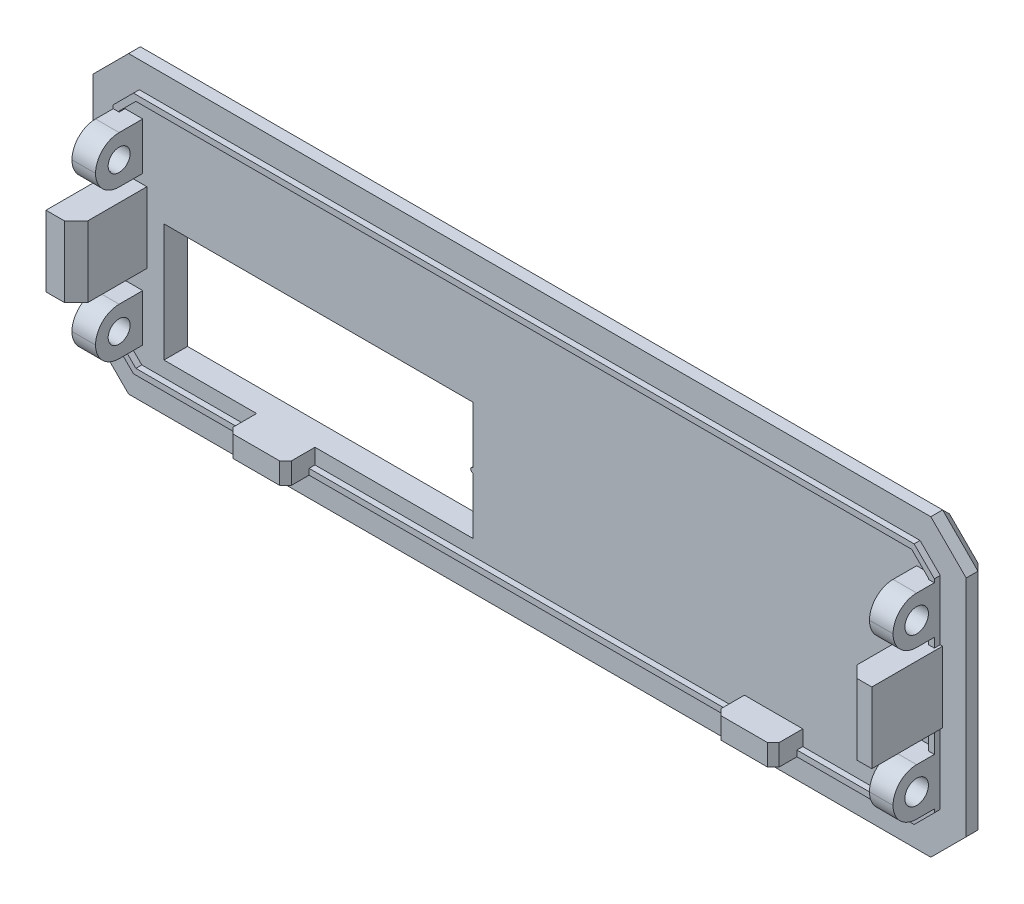
from build123d import *

# Parameters (mm, degrees)
EXTRUDE_1_DEPTH               = 2
CHAMFER_1_SIZE                = 1
SKETCH_3_W                    = 2
SKETCH_3_H                    = 4
EXTRUDE_2_DEPTH               = 4
FILLET_1_R                    = 2
SKETCH_4_R                    = 1
CUT_EXTRUDE_1_DEPTH           = 2
CUT_EXTRUDE_1_DRAFT           = -2
CUT_EXTRUDE_1_PROFILE_2_DEPTH = 2
CUT_EXTRUDE_1_PROFILE_2_DRAFT = -2
SKETCH_5_R                    = 1
CUT_EXTRUDE_2_DEPTH           = 2
CUT_EXTRUDE_2_DRAFT           = -2
CUT_EXTRUDE_2_PROFILE_2_DEPTH = 2
CUT_EXTRUDE_2_PROFILE_2_DRAFT = -2
SKETCH_8_W                    = 2.55
SKETCH_8_H                    = 6
SKETCH_8_W_2                  = 2.25
EXTRUDE_5_DEPTH               = 6
CHAMFER_3_SIZE                = 1
CUT_EXTRUDE_3_REACH           = 46.057
SKETCH_10_W                   = 26.2
SKETCH_10_H                   = 10
EXTRUDE_7_DEPTH               = 0.5
SKETCH_12_W                   = 4.95
SKETCH_12_H                   = 1.8
EXTRUDE_8_DEPTH               = 2.5
CHAMFER_4_SIZE                = 0.5
SKETCH_13_R                   = 0.2
EXTRUDE_9_DEPTH               = 2


with BuildPart() as part:
    # 草图1 → 凸台-拉伸1 (new body)
    with BuildSketch(Plane.XY):
        Polygon((-39.76383505, 4.799206062), (-36.76383505, 7.799206062), (31.23616495, 7.799206062), (34.23616495, 4.799206062), (34.23616495, -14.200793938), (31.23616495, -17.200793938), (-36.76383505, -17.200793938), (-39.76383505, -14.200793938), align=None)
    extrude(amount=EXTRUDE_1_DEPTH)

    # 倒角1
    chamfer_1_edges = [part.edges().sort_by_distance(p)[0] for p in [
        (-38.26383505, -15.700793938, 0),
        (-39.76383505, -4.700793938, 0),
        (-38.26383505, 6.299206062, 0),
        (-2.76383505, 7.799206062, 0),
        (32.73616495, 6.299206062, 0),
        (34.23616495, -4.700793938, 0),
        (32.73616495, -15.700793938, 0),
        (-2.76383505, -17.200793938, 0),
    ]]
    chamfer(chamfer_1_edges, length=CHAMFER_1_SIZE)

    # 草图3 → 凸台-拉伸2 (add)
    with BuildSketch(Plane.XY.offset(2)):
        with Locations((-36.56383505, 1.599206062)):
            Rectangle(SKETCH_3_W, SKETCH_3_H)
        with Locations((-36.56383505, -11.000793938)):
            Rectangle(SKETCH_3_W, SKETCH_3_H)
        with Locations((31.03616495, 1.599206062)):
            Rectangle(SKETCH_3_W, SKETCH_3_H)
        with Locations((31.03616495, -11.000793938)):
            Rectangle(SKETCH_3_W, SKETCH_3_H)
    extrude(amount=EXTRUDE_2_DEPTH)

    # 圆角1
    fillet_1_edges = [part.edges().sort_by_distance(p)[0] for p in [
        (31.03616495, 3.599206062, 6),
        (31.03616495, -0.400793938, 6),
        (31.03616495, -9.000793938, 6),
        (31.03616495, -13.000793938, 6),
        (-36.56383505, -13.000793938, 6),
        (-36.56383505, -9.000793938, 6),
        (-36.56383505, 3.599206062, 6),
        (-36.56383505, -0.400793938, 6),
    ]]
    fillet(fillet_1_edges, radius=FILLET_1_R - 0.0001)  # a hair under: the kernel refuses the full size


with BuildPart() as cut_extrude_1_tool:
    # 草图4 → 切除-拉伸1 (with draft: the straight prism first)
    with BuildSketch(Plane(origin=(32.03616495, 0, 0), x_dir=(0, 0, -1), z_dir=(1, 0, 0))):
        with Locations((-4, 1.599206062)):
            Circle(SKETCH_4_R)
    extrude(amount=-CUT_EXTRUDE_1_DEPTH)
    # 切除-拉伸1: the draft: its side faces are tilted about the plane it starts from
    cut_extrude_1_sides = [cut_extrude_1_tool.faces().sort_by_distance(p)[0] for p in [
        (31.03616495, 1.599206062, 5),
    ]]
    draft(cut_extrude_1_sides, Plane(origin=(32.03616495, 0, 0), x_dir=(0, 0, -1), z_dir=(1, 0, 0)), CUT_EXTRUDE_1_DRAFT)


with BuildPart() as part_1:
    add(part.part)

    # 切除-拉伸1: cut by cut_extrude_1_tool
    add(cut_extrude_1_tool.part, mode=Mode.SUBTRACT)


with BuildPart() as cut_extrude_1_profile_2_tool:
    # 草图4 → 切除-拉伸1 profile 2 (with draft: the straight prism first)
    with BuildSketch(Plane(origin=(32.03616495, 0, 0), x_dir=(0, 0, -1), z_dir=(1, 0, 0))):
        with Locations((-4, -11.000793938)):
            Circle(SKETCH_4_R)
    extrude(amount=-CUT_EXTRUDE_1_PROFILE_2_DEPTH)
    # 切除-拉伸1 profile 2: the draft: its side faces are tilted about the plane it starts from
    cut_extrude_1_profile_2_sides = [cut_extrude_1_profile_2_tool.faces().sort_by_distance(p)[0] for p in [
        (31.03616495, -11.000793938, 5),
    ]]
    draft(cut_extrude_1_profile_2_sides, Plane(origin=(32.03616495, 0, 0), x_dir=(0, 0, -1), z_dir=(1, 0, 0)), CUT_EXTRUDE_1_PROFILE_2_DRAFT)


with BuildPart() as part_2:
    add(part_1.part)

    # 切除-拉伸1 profile 2: cut by cut_extrude_1_profile_2_tool
    add(cut_extrude_1_profile_2_tool.part, mode=Mode.SUBTRACT)


with BuildPart() as cut_extrude_2_tool:
    # 草图5 → 切除-拉伸2 (with draft: the straight prism first)
    with BuildSketch(Plane.ZY.offset(37.56383505)):
        with Locations((4, 1.599206062)):
            Circle(SKETCH_5_R)
    extrude(amount=-CUT_EXTRUDE_2_DEPTH)
    # 切除-拉伸2: the draft: its side faces are tilted about the plane it starts from
    cut_extrude_2_sides = [cut_extrude_2_tool.faces().sort_by_distance(p)[0] for p in [
        (-36.56383505, 1.599206062, 3),
    ]]
    draft(cut_extrude_2_sides, Plane.ZY.offset(37.56383505), CUT_EXTRUDE_2_DRAFT)


with BuildPart() as part_3:
    add(part_2.part)

    # 切除-拉伸2: cut by cut_extrude_2_tool
    add(cut_extrude_2_tool.part, mode=Mode.SUBTRACT)


with BuildPart() as cut_extrude_2_profile_2_tool:
    # 草图5 → 切除-拉伸2 profile 2 (with draft: the straight prism first)
    with BuildSketch(Plane.ZY.offset(37.56383505)):
        with Locations((4, -11.000793938)):
            Circle(SKETCH_5_R)
    extrude(amount=-CUT_EXTRUDE_2_PROFILE_2_DEPTH)
    # 切除-拉伸2 profile 2: the draft: its side faces are tilted about the plane it starts from
    cut_extrude_2_profile_2_sides = [cut_extrude_2_profile_2_tool.faces().sort_by_distance(p)[0] for p in [
        (-36.56383505, -11.000793938, 3),
    ]]
    draft(cut_extrude_2_profile_2_sides, Plane.ZY.offset(37.56383505), CUT_EXTRUDE_2_PROFILE_2_DRAFT)


with BuildPart() as part_4:
    add(part_3.part)

    # 切除-拉伸2 profile 2: cut by cut_extrude_2_profile_2_tool
    add(cut_extrude_2_profile_2_tool.part, mode=Mode.SUBTRACT)

    # 草图8 → 凸台-拉伸5 (add)
    with BuildSketch(Plane.XY.offset(2)):
        with Locations((-36.48883505, -4.200793938)):
            Rectangle(SKETCH_8_W, SKETCH_8_H)
        with Locations((31.11116495, -4.200793938)):
            Rectangle(SKETCH_8_W_2, SKETCH_8_H)
    extrude(amount=EXTRUDE_5_DEPTH)

    # 倒角3
    chamfer_3_edges = [part_4.edges().sort_by_distance(p)[0] for p in [
        (-35.21383505, -4.200793938, 8),
        (29.98616495, -4.200793938, 8),
    ]]
    chamfer(chamfer_3_edges, length=CHAMFER_3_SIZE)

    # 草图10 → 切除-拉伸3 (cut, up to next)
    with BuildSketch(Plane(origin=(0, 0, 0), x_dir=(-1, 0, 0), z_dir=(0, 0, -1)), mode=Mode.PRIVATE) as cut_extrude_3_sk1:
        with Locations((20.66383505, -8.200793938)):
            Rectangle(SKETCH_10_W, SKETCH_10_H)
    cut_extrude_3_tool1 = extrude(cut_extrude_3_sk1.sketch, amount=-CUT_EXTRUDE_3_REACH, mode=Mode.PRIVATE) & part_4.part
    add(cut_extrude_3_tool1.solids().sort_by_distance((-20.663835, -8.200794, 0))[0], mode=Mode.SUBTRACT)

    # 草图11 → 凸台-拉伸7 (add)
    with BuildSketch(Plane.XY.offset(2)):
        Polygon((30.324895113, 5.599206062), (-35.852565213, 5.599206062), (-37.56383505, 3.887936224), (-37.56383505, -13.289524101), (-35.852565213, -15.000793938), (30.324895113, -15.000793938), (32.03616495, -13.289524101), (32.03616495, 3.887936224), align=None)
        Polygon((30.117788331, 5.099206062), (-35.645458432, 5.099206062), (-37.06383505, 3.680829443), (-37.06383505, -13.08241732), (-35.645458432, -14.500793938), (30.117788331, -14.500793938), (31.53616495, -13.08241732), (31.53616495, 3.680829443), align=None, mode=Mode.SUBTRACT)
    extrude(amount=EXTRUDE_7_DEPTH)

    # 草图12 → 凸台-拉伸8 (add)
    with BuildSketch(Plane.XY.offset(2)):
        with Locations((17.91116495, -14.100793938)):
            Rectangle(SKETCH_12_W, SKETCH_12_H)
        with Locations((-23.43883505, -14.100793938)):
            Rectangle(SKETCH_12_W, SKETCH_12_H)
    extrude(amount=EXTRUDE_8_DEPTH)

    # 倒角4
    chamfer_4_edges = [part_4.edges().sort_by_distance(p)[0] for p in [
        (15.43616495, -14.100793938, 4.5),
        (20.38616495, -14.100793938, 4.5),
        (-25.91383505, -14.100793938, 4.5),
        (-20.96383505, -14.100793938, 4.5),
    ]]
    chamfer(chamfer_4_edges, length=CHAMFER_4_SIZE)

    # 草图13 → 凸台-拉伸9 (add)
    with BuildSketch(Plane(origin=(0, 0, 0), x_dir=(-1, 0, 0), z_dir=(0, 0, -1))):
        with Locations((7.56383505, -8.200793938)):
            Circle(SKETCH_13_R)
    extrude(amount=-EXTRUDE_9_DEPTH)


solid = part_4.part
